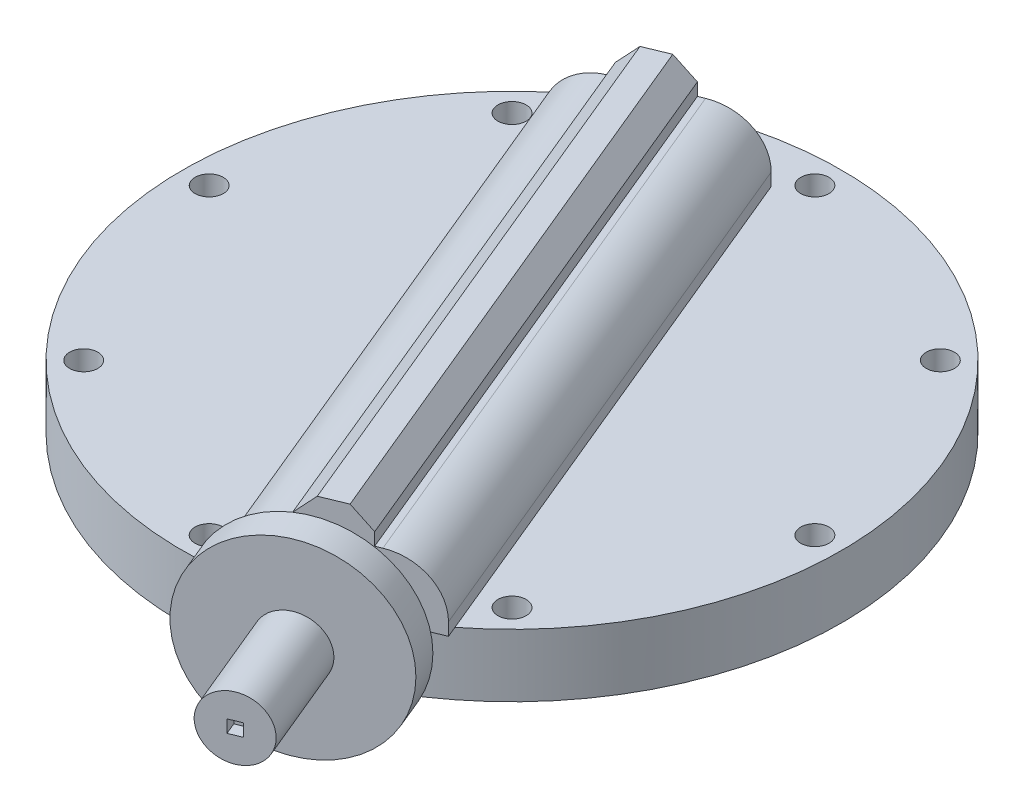
from build123d import *

# Parameters (mm, degrees)
SKETCH1_R           = 66.675
BOSS_EXTRUDE1_DEPTH = 12.7
SKETCH2_R           = 2.8575
CUT_EXTRUDE1_DEPTH  = 96.144107805
CIRPATTERN1_COUNT   = 8
BOSS_EXTRUDE2_DEPTH = 12.7
BOSS_EXTRUDE3_DEPTH = 6.35
CHAMFER1_SIZE       = 3.81
FILLET3_R           = 10.16
SKETCH7_R           = 10.16
BOSS_EXTRUDE4_DEPTH = 10.16
SKETCH8_R           = 19.05
BOSS_EXTRUDE5_DEPTH = 6.35
SKETCH9_R           = 6.35
BOSS_EXTRUDE6_DEPTH = 21.59
SKETCH11_W          = 2.54
SKETCH11_H          = 2.54
CUT_EXTRUDE2_DEPTH  = 2.54


with BuildPart() as part:
    # Sketch1 → Boss-Extrude1 (new body)
    with BuildSketch(Plane(origin=(0, 0, 0), x_dir=(1, 0, 0), z_dir=(0, 1, 0))):
        Circle(SKETCH1_R)
    extrude(amount=BOSS_EXTRUDE1_DEPTH)

    # Sketch2 → Cut-Extrude1 (cut, symmetric)
    with BuildSketch(Plane(origin=(0, 12.7, 0), x_dir=(1, 0, 0), z_dir=(0, 1, 0))):
        with Locations((0, 61.2775)):
            Circle(SKETCH2_R)
    cut_extrude1 = extrude(amount=CUT_EXTRUDE1_DEPTH, both=True, mode=Mode.SUBTRACT)

    # CirPattern1: Cut-Extrude1 ×8 about axis
    cirpattern1_axis = Axis((0, 12.7, 0), (0, 1, 0))
    for i in range(1, CIRPATTERN1_COUNT):
        add(cut_extrude1.rotate(cirpattern1_axis, i * 360 / CIRPATTERN1_COUNT), mode=Mode.SUBTRACT)

    # Sketch4 → Boss-Extrude2 (add)
    with BuildSketch(Plane(origin=(0, 12.7, 0), x_dir=(1, 0, 0), z_dir=(0, 1, 0))):
        Polygon((-37.08191635, 43.06228634), (-4.228760174, 56.670509195), (41.941995941, -54.795556403), (9.088839765, -68.403779258), align=None)
    extrude(amount=BOSS_EXTRUDE2_DEPTH)

    # Sketch5 → Boss-Extrude3 (add)
    with BuildSketch(Plane(origin=(0, 25.4, 0), x_dir=(1, 0, 0), z_dir=(0, 1, 0))):
        Polygon((-26.521973293, 47.436357972), (19.648782821, -64.029707626), (31.382052884, -59.169628035), (-14.78870323, 52.296437563), align=None)
    extrude(amount=BOSS_EXTRUDE3_DEPTH)

    # Chamfer1
    chamfer1_edges = [part.edges().sort_by_distance(p)[0] for p in [
        (8.296674827, 31.75, 3.436595236),
        (-3.436595236, 31.75, 8.296674827),
    ]]
    chamfer(chamfer1_edges, length=CHAMFER1_SIZE)

    # Fillet3
    fillet3_edges = [part.edges().sort_by_distance(p)[0] for p in [
        (18.856617884, 25.4, -0.937476396),
        (-13.996538293, 25.4, 12.670746459),
    ]]
    fillet(fillet3_edges, radius=FILLET3_R)

    # Sketch7 → Boss-Extrude4 (add)
    with BuildSketch(Plane(origin=(28.917473567, 0, 69.812956874), x_dir=(0.9238795325112883, 0, -0.3826834323650862), z_dir=(0.3826834323650862, 0, 0.9238795325112883))):
        with Locations((0, 15.875)):
            Circle(SKETCH7_R)
    extrude(amount=-BOSS_EXTRUDE4_DEPTH)

    # Sketch8 → Boss-Extrude5 (add)
    with BuildSketch(Plane(origin=(28.917473567, 0, 69.812956874), x_dir=(0.9238795325112883, 0, -0.3826834323650862), z_dir=(0.3826834323650862, 0, 0.9238795325112883))):
        with Locations((0, 15.875)):
            Circle(SKETCH8_R)
    extrude(amount=BOSS_EXTRUDE5_DEPTH)

    # Sketch9 → Boss-Extrude6 (add)
    with BuildSketch(Plane(origin=(31.347513362, 0, 75.679591906), x_dir=(0.9238795325112883, 0, -0.3826834323650862), z_dir=(0.3826834323650862, 0, 0.9238795325112883))):
        with Locations((0, 15.875)):
            Circle(SKETCH9_R)
    extrude(amount=BOSS_EXTRUDE6_DEPTH)

    # Sketch11 → Cut-Extrude2 (cut)
    with BuildSketch(Plane(origin=(39.609648667, 0, 95.626151013), x_dir=(0.9238795325112883, 0, -0.3826834323650862), z_dir=(0.3826834323650862, 0, 0.9238795325112883))):
        with Locations((0, 15.875)):
            Rectangle(SKETCH11_W, SKETCH11_H)
    extrude(amount=-CUT_EXTRUDE2_DEPTH, mode=Mode.SUBTRACT)


solid = part.part
